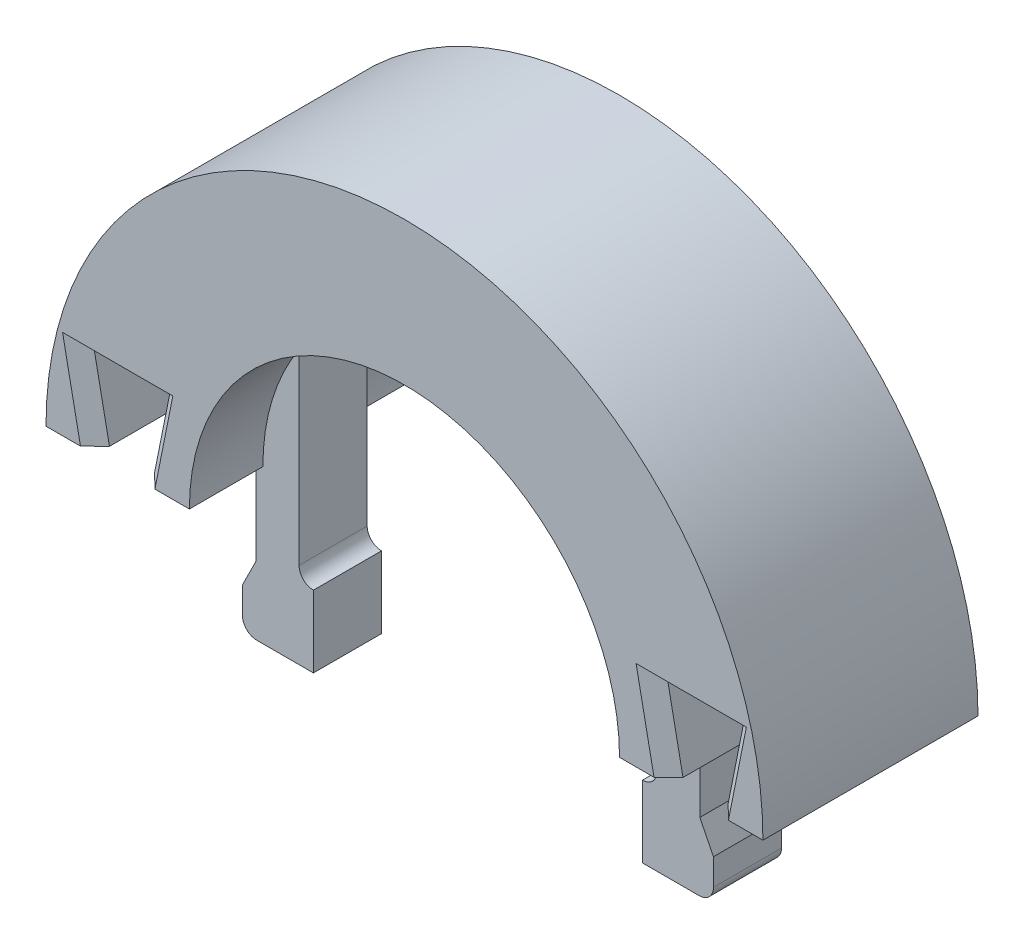
from build123d import *

# Parameters (mm, degrees)
BOSS_EXTRUDE1_DEPTH = 7.5
CUT_EXTRUDE1_DEPTH  = 39.405728739
BOSS_EXTRUDE3_DEPTH = 2.375
FILLET1_R           = 1
FILLET2_R           = 1
FILLET3_R           = 1
FILLET4_R           = 1
CHAMFER1_SIZE       = 1
CHAMFER2_SIZE       = 1


with BuildPart() as part:
    # Sketch1 → Boss-Extrude1 (new, symmetric)
    with BuildSketch(Plane.XY):
        with BuildLine():
            Line((-25, 0), (-15, 0))
            ThreePointArc((-15, 0), (0, 15), (15, 0))
            Line((15, 0), (25, 0))
            ThreePointArc((25, 0), (0, 25), (-25, 0))
        make_face()
    extrude(amount=BOSS_EXTRUDE1_DEPTH, both=True)

    # Sketch2 → Cut-Extrude1 (cut, through all)
    with BuildSketch(Plane.XY.offset(7.5)):
        Polygon((-22.625, 5.25), (-17.375, 5.25), (-18.425, 0), (-21.575, 0), align=None)
    cut_extrude1 = extrude(amount=-CUT_EXTRUDE1_DEPTH, mode=Mode.SUBTRACT)

    # Mirror1: Cut-Extrude1 across plane
    add(cut_extrude1.mirror(Plane(origin=(0, 0, 0), x_dir=(0, 0, 1), z_dir=(1, 0, 0))), mode=Mode.SUBTRACT)

    # Sketch3 → Boss-Extrude3 (add, symmetric)
    with BuildSketch(Plane.XY):
        with BuildLine():
            Line((12.475, 8.329128106), (12.475, -5.7))
            Line((12.475, -5.7), (11.475, -5.7))
            Line((11.475, -5.7), (11.475, -10.7))
            Line((11.475, -10.7), (16.425, -10.7))
            Line((16.425, -10.7), (16.425, -7.85))
            Line((16.425, -7.85), (15.475, -5.95))
            Line((15.475, -5.95), (15.475, 0))
            Line((15.475, 0), (15, 0))
            ThreePointArc((15, 0), (14.35487722, 4.351723796), (12.475, 8.329128106))
        make_face()
    boss_extrude3 = extrude(amount=BOSS_EXTRUDE3_DEPTH, both=True)

    # Mirror11: Boss-Extrude3 across plane
    add(boss_extrude3.mirror(Plane(origin=(0, 0, 0), x_dir=(0, 0, 1), z_dir=(1, 0, 0))))

    # Fillet1
    fillet1_edges = [part.edges().sort_by_distance(p)[0] for p in [
        (16.425, -10.7, 0),
    ]]
    fillet(fillet1_edges, radius=FILLET1_R)

    # Fillet2
    fillet2_edges = [part.edges().sort_by_distance(p)[0] for p in [
        (-16.425, -10.7, 0),
    ]]
    fillet(fillet2_edges, radius=FILLET2_R)

    # Fillet3
    fillet3_edges = [part.edges().sort_by_distance(p)[0] for p in [
        (-12.475, -5.7, 0),
    ]]
    fillet(fillet3_edges, radius=FILLET3_R - 0.0001)  # a hair under: the kernel refuses the full size

    # Fillet4
    fillet4_edges = [part.edges().sort_by_distance(p)[0] for p in [
        (12.475, -5.7, 0),
    ]]
    fillet(fillet4_edges, radius=FILLET4_R - 0.0001)  # a hair under: the kernel refuses the full size

    # Chamfer1
    chamfer1_edges = [part.edges().sort_by_distance(p)[0] for p in [
        (-20, 5.25, 7.5),
        (-22.1, 2.625, 7.5),
        (-17.9, 2.625, 7.5),
    ]]
    chamfer(chamfer1_edges, length=CHAMFER1_SIZE)

    # Chamfer2
    chamfer2_edges = [part.edges().sort_by_distance(p)[0] for p in [
        (22.1, 2.625, 7.5),
        (17.9, 2.625, 7.5),
        (20, 5.25, 7.5),
    ]]
    chamfer(chamfer2_edges, length=CHAMFER2_SIZE)


solid = part.part
